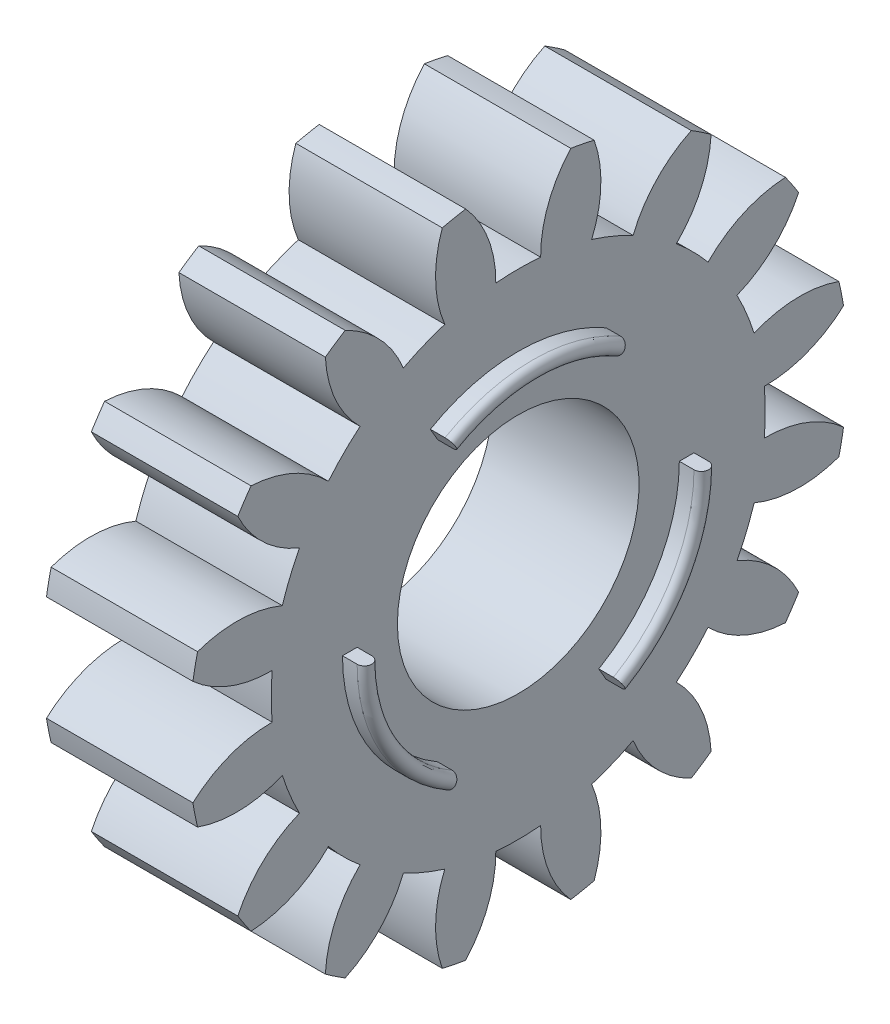
from build123d import *

# Parameters (mm, degrees)
BASPROSKE_W     = 2
BASPROSKE_H     = 4.5
TOOTHCUT_DEPTH  = 7.670832032
TEETHCUTS_COUNT = 16
TEETHCUTS_ANGLE = 337.5
BORSKE_R        = 1.65
BORE_DEPTH      = 50.0000508
EXTRUDE_2_DEPTH = 0.3
FILLET_4_R      = 0.1
FILLET_5_R      = 0.1
FILLET_6_R      = 0.1
EXTRUDE_START   = -2.3
EXTRUDE_5_DEPTH = 0.3
FILLET_7_R      = 0.1
FILLET_8_R      = 0.1
FILLET_9_R      = 0.1


with BuildPart() as part:
    # BasProSke → Base-Revolve (revolve)
    with BuildSketch(Plane(origin=(0, 0, 0), x_dir=(1, 0, 0), z_dir=(0, 1, 0)), mode=Mode.PRIVATE) as base_revolve_sk:
        with Locations((1, 2.25)):
            Rectangle(BASPROSKE_W, BASPROSKE_H)
    revolve(base_revolve_sk.sketch.rotate(Axis((-10, 0, 0), (1, 0, 0)), 180), axis=Axis((-10, 0, 0), (1, 0, 0)))

    # TooCutSke → ToothCut (cut, through all)
    with BuildSketch(Plane(origin=(0, 0, 0), x_dir=(0, 0, -1), z_dir=(1, 0, 0))):
        with BuildLine():
            ThreePointArc((0.306025637, 3.360092902), (0, 3.374), (-0.306025637, 3.360092902))
            ThreePointArc((-0.306025637, 3.360092902), (-0.415941512, 3.953968919), (-0.738171669, 4.464789776))
            ThreePointArc((-0.738171669, 4.464789776), (0, 4.5254), (0.738171669, 4.464789776))
            ThreePointArc((0.738171669, 4.464789776), (0.415941512, 3.953968919), (0.306025637, 3.360092902))
        make_face()
    toothcut = extrude(amount=TOOTHCUT_DEPTH, mode=Mode.SUBTRACT)

    # TeethCuts: ToothCut ×16 about axis
    teethcuts_axis = Axis((-10, 0, 0), (1, 0, 0))
    for i in range(1, TEETHCUTS_COUNT):
        add(toothcut.rotate(teethcuts_axis, i * TEETHCUTS_ANGLE / (TEETHCUTS_COUNT - 1)), mode=Mode.SUBTRACT)

    # BorSke → Bore (cut, symmetric)
    with BuildSketch(Plane(origin=(0, 0, 0), x_dir=(0, 0, -1), z_dir=(1, 0, 0))):
        with Locations(Location((0, 0, 0), (0, 0, 180))):
            Circle(BORSKE_R)
    extrude(amount=BORE_DEPTH, both=True, mode=Mode.SUBTRACT)

    # 草图1 → 拉伸-薄壁2 (add)
    with BuildSketch(Plane(origin=(2, 0, 0), x_dir=(0, 0, -1), z_dir=(1, 0, 0))):
        with BuildLine():
            ThreePointArc((-1.1, 1.905255888), (0, 2.2), (1.1, 1.905255888))
            Line((1.1, 1.905255888), (1.2, 2.078460969))
            ThreePointArc((1.2, 2.078460969), (0, 2.4), (-1.2, 2.078460969))
            Line((-1.2, 2.078460969), (-1.1, 1.905255888))
        make_face()
        with BuildLine():
            ThreePointArc((2.2, 0), (1.905255888, -1.1), (1.1, -1.905255888))
            Line((1.1, -1.905255888), (1.2, -2.078460969))
            ThreePointArc((1.2, -2.078460969), (2.078460969, -1.2), (2.4, 0))
            Line((2.4, 0), (2.2, 0))
        make_face()
        with BuildLine():
            ThreePointArc((-1.1, -1.905255888), (-1.905255888, -1.1), (-2.2, 0))
            Line((-2.2, 0), (-2.4, 0))
            ThreePointArc((-2.4, 0), (-2.078460969, -1.2), (-1.2, -2.078460969))
            Line((-1.2, -2.078460969), (-1.1, -1.905255888))
        make_face()
    extrude(amount=EXTRUDE_2_DEPTH)

    # 圆角4
    # the kernel refuses this fillet: 0.1 mm, written as the material it takes off along each edge
    with BuildSketch(Plane(origin=(2.3, 0, 0), x_dir=(0, 0.10399688261682524, 0.994577623117463), z_dir=(0, 0.994577623117463, -0.10399688261682524))) as fillet_4_piece_1:
        with BuildLine():
            CenterArc((2.4 - FILLET_4_R, -FILLET_4_R), FILLET_4_R, 0, 90)
            Line((2.4 - FILLET_4_R, 0), (2.4, 0))
            Line((2.4, 0), (2.4, -FILLET_4_R))
        make_face()
    revolve(axis=Axis((2.3, 0, 0), (1, 0, 0)), revolution_arc=71.938751527, mode=Mode.SUBTRACT)
    with BuildSketch(Plane(origin=(2.3, 0, 0), x_dir=(0, -0.9171438900620574, 0.39855625063701683), z_dir=(0, -0.39855625063701683, -0.9171438900620574))) as fillet_4_piece_2:
        with BuildLine():
            CenterArc((2.2 + FILLET_4_R, FILLET_4_R), FILLET_4_R, 180, 90)
            Line((2.2 + FILLET_4_R, 0), (2.2, 0))
            Line((2.2, 0), (2.2, FILLET_4_R))
        make_face()
    revolve(axis=Axis((2.3, 0, 0), (-1, 0, 0)), revolution_arc=73.024092575, mode=Mode.SUBTRACT)

    # 圆角5
    # the kernel refuses this fillet: 0.1 mm, written as the material it takes off along each edge
    with BuildSketch(Plane(origin=(2.3, 0, 0), x_dir=(0, 0.809331046346937, -0.5873527538191783), z_dir=(0, -0.5873527538191783, -0.809331046346937))) as fillet_5_piece_1:
        with BuildLine():
            CenterArc((2.4 - FILLET_5_R, -FILLET_5_R), FILLET_5_R, 0, 90)
            Line((2.4 - FILLET_5_R, 0), (2.4, 0))
            Line((2.4, 0), (2.4, -FILLET_5_R))
        make_face()
    revolve(axis=Axis((2.3, 0, 0), (1, 0, 0)), revolution_arc=71.938751527, mode=Mode.SUBTRACT)
    with BuildSketch(Plane(origin=(2.3, 0, 0), x_dir=(0, 0.8037317829196821, 0.5949917824010252), z_dir=(0, -0.5949917824010252, 0.8037317829196821))) as fillet_5_piece_2:
        with BuildLine():
            CenterArc((2.2 + FILLET_5_R, FILLET_5_R), FILLET_5_R, 180, 90)
            Line((2.2 + FILLET_5_R, 0), (2.2, 0))
            Line((2.2, 0), (2.2, FILLET_5_R))
        make_face()
    revolve(axis=Axis((2.3, 0, 0), (-1, 0, 0)), revolution_arc=73.024092575, mode=Mode.SUBTRACT)

    # 圆角6
    # the kernel refuses this fillet: 0.1 mm, written as the material it takes off along each edge
    with BuildSketch(Plane(origin=(2.3, 0, 0), x_dir=(0, -0.9133279289636526, -0.4072248692982359), z_dir=(0, -0.4072248692982359, 0.9133279289636526))) as fillet_6_piece_1:
        with BuildLine():
            CenterArc((2.4 - FILLET_6_R, -FILLET_6_R), FILLET_6_R, 0, 90)
            Line((2.4 - FILLET_6_R, 0), (2.4, 0))
            Line((2.4, 0), (2.4, -FILLET_6_R))
        make_face()
    revolve(axis=Axis((2.3, 0, 0), (1, 0, 0)), revolution_arc=71.938751527, mode=Mode.SUBTRACT)
    with BuildSketch(Plane(origin=(2.3, 0, 0), x_dir=(0, 0.11341210714236213, -0.9935480330379249), z_dir=(0, 0.9935480330379249, 0.11341210714236213))) as fillet_6_piece_2:
        with BuildLine():
            CenterArc((2.2 + FILLET_6_R, FILLET_6_R), FILLET_6_R, 180, 90)
            Line((2.2 + FILLET_6_R, 0), (2.2, 0))
            Line((2.2, 0), (2.2, FILLET_6_R))
        make_face()
    revolve(axis=Axis((2.3, 0, 0), (-1, 0, 0)), revolution_arc=73.024092575, mode=Mode.SUBTRACT)

    # 草图1<5> → 拉伸-薄壁5 (add)
    with BuildSketch(Plane(origin=(2, 0, 0), x_dir=(0, 0, -1), z_dir=(1, 0, 0)).offset(EXTRUDE_START)):
        with BuildLine():
            ThreePointArc((-1.1, 1.905255888), (0, 2.2), (1.1, 1.905255888))
            Line((1.1, 1.905255888), (1.2, 2.078460969))
            ThreePointArc((1.2, 2.078460969), (0, 2.4), (-1.2, 2.078460969))
            Line((-1.2, 2.078460969), (-1.1, 1.905255888))
        make_face()
        with BuildLine():
            ThreePointArc((2.2, 0), (1.905255888, -1.1), (1.1, -1.905255888))
            Line((1.1, -1.905255888), (1.2, -2.078460969))
            ThreePointArc((1.2, -2.078460969), (2.078460969, -1.2), (2.4, 0))
            Line((2.4, 0), (2.2, 0))
        make_face()
        with BuildLine():
            ThreePointArc((-1.1, -1.905255888), (-1.905255888, -1.1), (-2.2, 0))
            Line((-2.2, 0), (-2.4, 0))
            ThreePointArc((-2.4, 0), (-2.078460969, -1.2), (-1.2, -2.078460969))
            Line((-1.2, -2.078460969), (-1.1, -1.905255888))
        make_face()
    extrude(amount=EXTRUDE_5_DEPTH)

    # 圆角7
    # the kernel refuses this fillet: 0.1 mm, written as the material it takes off along each edge
    with BuildSketch(Plane(origin=(-0.3, 0, 0), x_dir=(0, 0.809331046346937, -0.5873527538191783), z_dir=(0, -0.5873527538191783, -0.809331046346937))) as fillet_7_piece_1:
        with BuildLine():
            CenterArc((2.4 - FILLET_7_R, FILLET_7_R), FILLET_7_R, 270, 90)
            Line((2.4 - FILLET_7_R, 0), (2.4, 0))
            Line((2.4, 0), (2.4, FILLET_7_R))
        make_face()
    revolve(axis=Axis((-0.3, 0, 0), (1, 0, 0)), revolution_arc=71.938751527, mode=Mode.SUBTRACT)
    with BuildSketch(Plane(origin=(-0.3, 0, 0), x_dir=(0, 0.8037317829196821, 0.5949917824010252), z_dir=(0, -0.5949917824010252, 0.8037317829196821))) as fillet_7_piece_2:
        with BuildLine():
            CenterArc((2.2 + FILLET_7_R, -FILLET_7_R), FILLET_7_R, 90, 90)
            Line((2.2 + FILLET_7_R, 0), (2.2, 0))
            Line((2.2, 0), (2.2, -FILLET_7_R))
        make_face()
    revolve(axis=Axis((-0.3, 0, 0), (-1, 0, 0)), revolution_arc=73.024092575, mode=Mode.SUBTRACT)

    # 圆角8
    # the kernel refuses this fillet: 0.1 mm, written as the material it takes off along each edge
    with BuildSketch(Plane(origin=(-0.3, 0, 0), x_dir=(0, 0.10399688261682512, 0.994577623117463), z_dir=(0, 0.994577623117463, -0.10399688261682512))) as fillet_8_piece_1:
        with BuildLine():
            CenterArc((2.4 - FILLET_8_R, FILLET_8_R), FILLET_8_R, 270, 90)
            Line((2.4 - FILLET_8_R, 0), (2.4, 0))
            Line((2.4, 0), (2.4, FILLET_8_R))
        make_face()
    revolve(axis=Axis((-0.3, 0, 0), (1, 0, 0)), revolution_arc=71.938751527, mode=Mode.SUBTRACT)
    with BuildSketch(Plane(origin=(-0.3, 0, 0), x_dir=(0, -0.9171438900620574, 0.39855625063701694), z_dir=(0, -0.39855625063701694, -0.9171438900620574))) as fillet_8_piece_2:
        with BuildLine():
            CenterArc((2.2 + FILLET_8_R, -FILLET_8_R), FILLET_8_R, 90, 90)
            Line((2.2 + FILLET_8_R, 0), (2.2, 0))
            Line((2.2, 0), (2.2, -FILLET_8_R))
        make_face()
    revolve(axis=Axis((-0.3, 0, 0), (-1, 0, 0)), revolution_arc=73.024092575, mode=Mode.SUBTRACT)

    # 圆角9
    # the kernel refuses this fillet: 0.1 mm, written as the material it takes off along each edge
    with BuildSketch(Plane(origin=(-0.3, 0, 0), x_dir=(0, -0.9133279289636526, -0.4072248692982359), z_dir=(0, -0.4072248692982359, 0.9133279289636526))) as fillet_9_piece_1:
        with BuildLine():
            CenterArc((2.4 - FILLET_9_R, FILLET_9_R), FILLET_9_R, 270, 90)
            Line((2.4 - FILLET_9_R, 0), (2.4, 0))
            Line((2.4, 0), (2.4, FILLET_9_R))
        make_face()
    revolve(axis=Axis((-0.3, 0, 0), (1, 0, 0)), revolution_arc=71.938751527, mode=Mode.SUBTRACT)
    with BuildSketch(Plane(origin=(-0.3, 0, 0), x_dir=(0, 0.11341210714236213, -0.9935480330379249), z_dir=(0, 0.9935480330379249, 0.11341210714236213))) as fillet_9_piece_2:
        with BuildLine():
            CenterArc((2.2 + FILLET_9_R, -FILLET_9_R), FILLET_9_R, 90, 90)
            Line((2.2 + FILLET_9_R, 0), (2.2, 0))
            Line((2.2, 0), (2.2, -FILLET_9_R))
        make_face()
    revolve(axis=Axis((-0.3, 0, 0), (-1, 0, 0)), revolution_arc=73.024092575, mode=Mode.SUBTRACT)


solid = part.part
